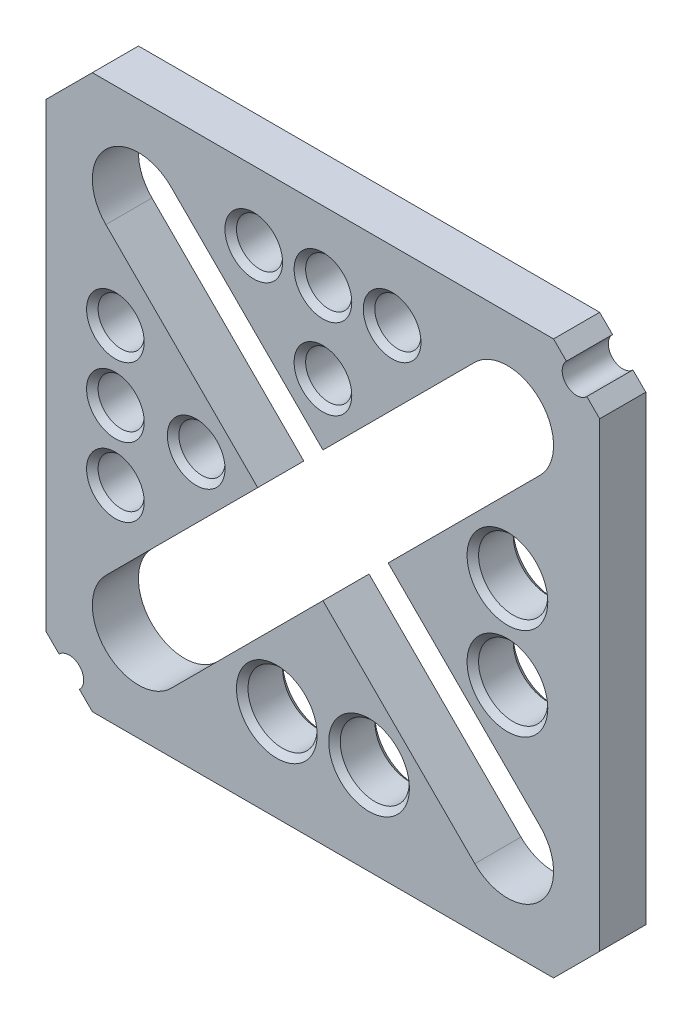
from build123d import *

# Parameters (mm, degrees)
SKETCH1_W            = 76.2
SKETCH1_H            = 76.2
EXTRUSION1_DEPTH     = 6.35
EXTRUSION2_DEPTH     = 55.254423783
MIRROR2_COPY_1_DEPTH = 55.254423783
SKETCH3_R            = 1.984375
EXTRUSION3_DEPTH     = 55.254423783
HOLE3_START          = -49.391408666
HOLE3_OUTLINE_R      = 1.7272
HOLE3_DEPTH          = 13.470384182
MIRROR4_START        = 35.921024484
MIRROR4_OUTLINE_R    = 1.7272
MIRROR4_DEPTH        = 13.470384182


with BuildPart() as part:
    # Sketch1 → Extrusion1 (new body)
    with BuildSketch(Plane.XY):
        Rectangle(SKETCH1_W, SKETCH1_H)
        with BuildLine():
            ThreePointArc((-29.890128061, -20.909871939), (-29.890128061, -29.890128061), (-20.909871939, -29.890128061))
            Line((-20.909871939, -29.890128061), (0, -8.980256121))
            Line((0, -8.980256121), (20.909871939, -29.890128061))
            ThreePointArc((20.909871939, -29.890128061), (29.890128061, -29.890128061), (29.890128061, -20.909871939))
            Line((29.890128061, -20.909871939), (8.980256121, 0))
            Line((8.980256121, 0), (29.890128061, 20.909871939))
            ThreePointArc((29.890128061, 20.909871939), (29.890128061, 29.890128061), (20.909871939, 29.890128061))
            Line((20.909871939, 29.890128061), (0, 8.980256121))
            Line((0, 8.980256121), (-20.909871939, 29.890128061))
            ThreePointArc((-20.909871939, 29.890128061), (-29.890128061, 29.890128061), (-29.890128061, 20.909871939))
            Line((-29.890128061, 20.909871939), (-8.980256121, 0))
            Line((-8.980256121, 0), (-29.890128061, -20.909871939))
        make_face(mode=Mode.SUBTRACT)
    extrude(amount=EXTRUSION1_DEPTH)

    # Sketch2 → Extrusion2 (cut, through all)
    with BuildSketch(Plane.XY.offset(6.35)):
        Polygon((-38.1, 38.1), (-38.1, 31.75), (-31.75, 38.1), align=None)
    extrusion2 = extrude(amount=-EXTRUSION2_DEPTH, mode=Mode.SUBTRACT)

    # Mirror1: Extrusion2 across plane
    add(extrusion2.mirror(Plane.ZX), mode=Mode.SUBTRACT)

    # Mirror2: Extrusion2 across plane
    add(extrusion2.mirror(Plane(origin=(0, 0, 0), x_dir=(0, 0, 1), z_dir=(1, 0, 0))), mode=Mode.SUBTRACT)

    # Mirror2 copy 1 sketch → Mirror2 copy 1 (cut, through all)
    with BuildSketch(Plane(origin=(0, 0, 6.35), x_dir=(-1, 0, 0), z_dir=(0, 0, 1))):
        Polygon((-38.1, 38.1), (-38.1, 31.75), (-31.75, 38.1), align=None)
    extrude(amount=-MIRROR2_COPY_1_DEPTH, mode=Mode.SUBTRACT)

    # Sketch3 → Extrusion3 (cut, through all)
    with BuildSketch(Plane.XY.offset(6.35)):
        with Locations((34.925, 34.925)):
            Circle(SKETCH3_R)
    extrusion3 = extrude(amount=-EXTRUSION3_DEPTH, mode=Mode.SUBTRACT)

    # Mirror3: Extrusion3 across plane
    add(extrusion3.mirror(Plane(origin=(0, 0, 6.35), x_dir=(0, 0, 1), z_dir=(0.7071067811865472, 0.7071067811865478, 0))), mode=Mode.SUBTRACT)

    # Chamfer1: read off the stored shape, not the designer's step
    # Chamfer1 outline → Chamfer1 (revolve, cut)
    with BuildSketch(Plane(origin=(-17.4498, 0, 0), x_dir=(1, 0, 0), z_dir=(0, -1, 0))):
        Polygon((0, 0), (3.96875, 0), (3.175, 0.79375), (3.175, 5.55625), (3.96875, 6.35), (0, 6.35), align=None)
    revolve(axis=Axis((-17.4498, 0, 0), (0, 0, 1)), mode=Mode.SUBTRACT)

    # Chamfer1 2 outline → Chamfer1 2 (revolve, cut)
    with BuildSketch(Plane(origin=(-28.575, -9.525, 0), x_dir=(1, 0, 0), z_dir=(0, -1, 0))):
        Polygon((0, 0), (3.96875, 0), (3.175, 0.79375), (3.175, 5.55625), (3.96875, 6.35), (0, 6.35), align=None)
    revolve(axis=Axis((-28.575, -9.525, 0), (0, 0, 1)), mode=Mode.SUBTRACT)

    # Chamfer1 3 outline → Chamfer1 3 (revolve, cut)
    with BuildSketch(Plane(origin=(-28.575, 0, 0), x_dir=(1, 0, 0), z_dir=(0, -1, 0))):
        Polygon((0, 0), (3.96875, 0), (3.175, 0.79375), (3.175, 5.55625), (3.96875, 6.35), (0, 6.35), align=None)
    revolve(axis=Axis((-28.575, 0, 0), (0, 0, 1)), mode=Mode.SUBTRACT)

    # Chamfer1 4 outline → Chamfer1 4 (revolve, cut)
    with BuildSketch(Plane(origin=(-28.575, 9.525, 0), x_dir=(1, 0, 0), z_dir=(0, -1, 0))):
        Polygon((0, 0), (3.96875, 0), (3.175, 0.79375), (3.175, 5.55625), (3.96875, 6.35), (0, 6.35), align=None)
    revolve(axis=Axis((-28.575, 9.525, 0), (0, 0, 1)), mode=Mode.SUBTRACT)

    # Chamfer1 5 outline → Chamfer1 5 (revolve, cut)
    with BuildSketch(Plane(origin=(-9.525, 28.575, 0), x_dir=(1, 0, 0), z_dir=(0, -1, 0))):
        Polygon((0, 0), (3.96875, 0), (3.175, 0.79375), (3.175, 5.55625), (3.96875, 6.35), (0, 6.35), align=None)
    revolve(axis=Axis((-9.525, 28.575, 0), (0, 0, 1)), mode=Mode.SUBTRACT)

    # Chamfer1 6 outline → Chamfer1 6 (revolve, cut)
    with BuildSketch(Plane(origin=(9.525, 28.575, 0), x_dir=(1, 0, 0), z_dir=(0, -1, 0))):
        Polygon((0, 0), (3.96875, 0), (3.175, 0.79375), (3.175, 5.55625), (3.96875, 6.35), (0, 6.35), align=None)
    revolve(axis=Axis((9.525, 28.575, 0), (0, 0, 1)), mode=Mode.SUBTRACT)

    # Chamfer1 7 outline → Chamfer1 7 (revolve, cut)
    with BuildSketch(Plane.XZ.offset(-28.575)):
        Polygon((0, 0), (3.96875, 0), (3.175, 0.79375), (3.175, 5.55625), (3.96875, 6.35), (0, 6.35), align=None)
    revolve(axis=Axis((0, 28.575, 0), (0, 0, 1)), mode=Mode.SUBTRACT)

    # Chamfer1 8 outline → Chamfer1 8 (revolve, cut)
    with BuildSketch(Plane.XZ.offset(-17.4752)):
        Polygon((0, 0), (3.96875, 0), (3.175, 0.79375), (3.175, 5.55625), (3.96875, 6.35), (0, 6.35), align=None)
    revolve(axis=Axis((0, 17.4752, 0), (0, 0, 1)), mode=Mode.SUBTRACT)

    # Hole3: read off the stored shape, not the designer's step
    # Hole3 outline → Hole3 (cut)
    with BuildSketch(Plane(origin=(0, 0, 0), x_dir=(0.7071067811865471, 0.707106781186548, 0), z_dir=(0.707106781186548, -0.707106781186547, 0)).offset(HOLE3_START)):
        with Locations((0, 3.175)):
            Circle(HOLE3_OUTLINE_R)
    extrude(amount=HOLE3_DEPTH, mode=Mode.SUBTRACT)

    # Hole3 2 outline → Hole3 2 (revolve, cut)
    with BuildSketch(Plane(origin=(-6.35, -25.4, 0), x_dir=(1, 0, 0), z_dir=(0, -1, 0))):
        Polygon((0, 0), (5.55625, 0), (4.7625, 0.79375), (4.7625, 5.55625), (5.55625, 6.35), (0, 6.35), align=None)
    revolve(axis=Axis((-6.35, -25.4, 0), (0, 0, 1)), mode=Mode.SUBTRACT)

    # Hole3 3 outline → Hole3 3 (revolve, cut)
    with BuildSketch(Plane(origin=(6.35, -25.4, 0), x_dir=(1, 0, 0), z_dir=(0, -1, 0))):
        Polygon((0, 0), (5.55625, 0), (4.7625, 0.79375), (4.7625, 5.55625), (5.55625, 6.35), (0, 6.35), align=None)
    revolve(axis=Axis((6.35, -25.4, 0), (0, 0, 1)), mode=Mode.SUBTRACT)

    # Hole3 4 outline → Hole3 4 (revolve, cut)
    with BuildSketch(Plane(origin=(25.4, -6.35, 0), x_dir=(1, 0, 0), z_dir=(0, -1, 0))):
        Polygon((0, 0), (5.55625, 0), (4.7625, 0.79375), (4.7625, 5.55625), (5.55625, 6.35), (0, 6.35), align=None)
    revolve(axis=Axis((25.4, -6.35, 0), (0, 0, 1)), mode=Mode.SUBTRACT)

    # Hole3 5 outline → Hole3 5 (revolve, cut)
    with BuildSketch(Plane(origin=(25.4, 6.35, 0), x_dir=(1, 0, 0), z_dir=(0, -1, 0))):
        Polygon((0, 0), (5.55625, 0), (4.7625, 0.79375), (4.7625, 5.55625), (5.55625, 6.35), (0, 6.35), align=None)
    revolve(axis=Axis((25.4, 6.35, 0), (0, 0, 1)), mode=Mode.SUBTRACT)

    # Mirror4: read off the stored shape, not the designer's step
    # Mirror4 outline → Mirror4 (cut)
    with BuildSketch(Plane(origin=(0, 0, 0), x_dir=(0.707106781186548, 0.707106781186547, 0), z_dir=(0.707106781186547, -0.707106781186548, 0)).offset(MIRROR4_START)):
        with Locations((0, 3.175)):
            Circle(MIRROR4_OUTLINE_R)
    extrude(amount=MIRROR4_DEPTH, mode=Mode.SUBTRACT)


solid = part.part
